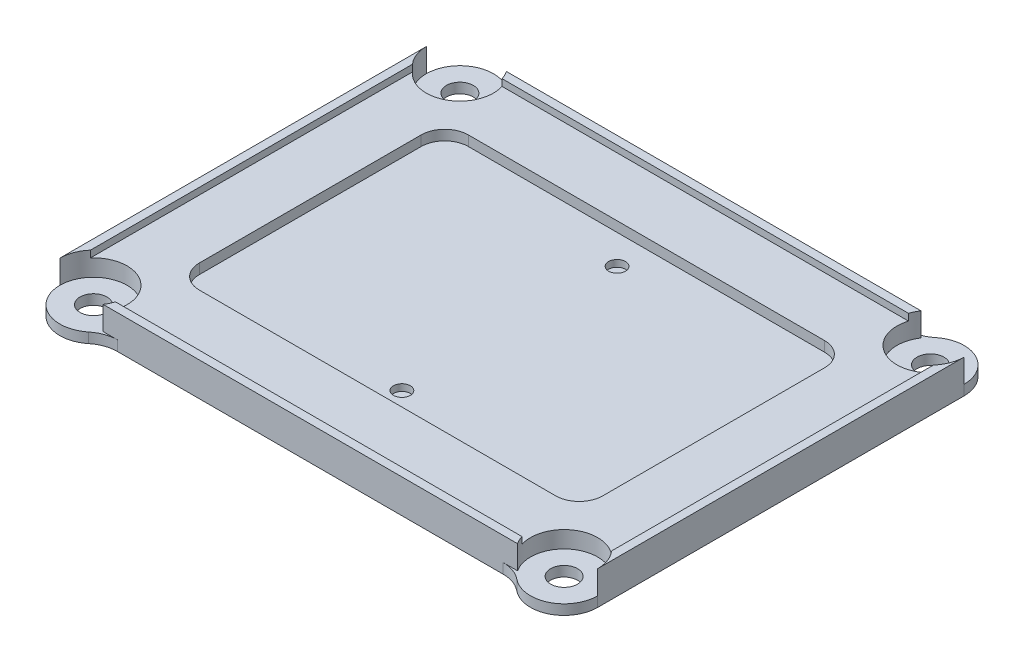
from build123d import *

# Parameters (mm, degrees)
SKETCH1_W               = 160
SKETCH1_H               = 129
BOSS_EXTRUDE1_DEPTH     = 8
SKETCH1_3_R             = 4
CUT_EXTRUDE2_DEPTH      = 104.074002542
FILLET1_R               = 10
CUT_EXTRUDE4_DEPTH      = 1
CUT_EXTRUDE4_DEPTH_BACK = 3
CUT_EXTRUDE4_START      = 8
CUT_EXTRUDE9_DEPTH      = 104.074002542
CUT_EXTRUDE10_START     = 8
SKETCH1_17_R            = 2.5
SKETCH1_17_R_2          = 10
CUT_EXTRUDE10_DEPTH     = 5
BOSS_EXTRUDE4_START     = 10
BOSS_EXTRUDE4_DEPTH     = 10
FILLET2_R               = 10


with BuildPart() as part:
    # Sketch1 → Boss-Extrude1 (new body)
    with BuildSketch(Plane(origin=(0, 0, 0), x_dir=(1, 0, 0), z_dir=(0, 1, 0))):
        Rectangle(SKETCH1_W, SKETCH1_H)
    extrude(amount=BOSS_EXTRUDE1_DEPTH)

    # Sketch1<3> → Cut-Extrude2 (cut, through all)
    with BuildSketch(Plane(origin=(0, 0, 0), x_dir=(1, 0, 0), z_dir=(0, 1, 0))):
        with Locations(Location((-70, 54.5, 0), (0, 0, 270))):
            Circle(SKETCH1_3_R)
        with Locations(Location((-70, -54.5, 0), (0, 0, 270))):
            Circle(SKETCH1_3_R)
        with Locations(Location((70, -54.5, 0), (0, 0, 90))):
            Circle(SKETCH1_3_R)
        with Locations(Location((70, 54.5, 0), (0, 0, 90))):
            Circle(SKETCH1_3_R)
    extrude(amount=CUT_EXTRUDE2_DEPTH, mode=Mode.SUBTRACT)

    # Fillet1
    fillet1_edges = [part.edges().sort_by_distance(p)[0] for p in [
        (80, 4, 64.5),
        (-80, 4, 64.5),
        (-80, 4, -64.5),
        (80, 4, -64.5),
    ]]
    fillet(fillet1_edges, radius=FILLET1_R)

    # Sketch1<11> → Cut-Extrude4 (cut, two sides: drawn at the far end of the back side and taken through both)
    with BuildSketch(Plane(origin=(0, 0, 0), x_dir=(1, 0, 0), z_dir=(0, 1, 0)).offset(CUT_EXTRUDE4_START - CUT_EXTRUDE4_DEPTH_BACK)):
        with BuildLine():
            Line((53, -40), (-53, -40))
            ThreePointArc((-53, -40), (-57.949747468, -37.949747468), (-60, -33))
            Line((-60, -33), (-60, 33))
            ThreePointArc((-60, 33), (-57.949747468, 37.949747468), (-53, 40))
            Line((-53, 40), (53, 40))
            ThreePointArc((53, 40), (57.949747468, 37.949747468), (60, 33))
            Line((60, 33), (60, -33))
            ThreePointArc((60, -33), (57.949747468, -37.949747468), (53, -40))
        make_face()
    extrude(amount=CUT_EXTRUDE4_DEPTH + CUT_EXTRUDE4_DEPTH_BACK, mode=Mode.SUBTRACT)

    # Sketch1<13> → Cut-Extrude9 (cut, through all)
    with BuildSketch(Plane(origin=(0, 0, 0), x_dir=(1, 0, 0), z_dir=(0, 1, 0))):
        with BuildLine():
            Line((-70, -64.5), (70, -64.5))
            ThreePointArc((70, -64.5), (65.25658351, -63.303408431), (61.648353456, -60))
            Line((61.648353456, -60), (-61.648353456, -60))
            ThreePointArc((-61.648353456, -60), (-65.25658351, -63.303408431), (-70, -64.5))
        make_face()
        with BuildLine():
            ThreePointArc((61.648353456, 60), (65.25658351, 63.303408431), (70, 64.5))
            Line((70, 64.5), (-69.999999984, 64.5))
            ThreePointArc((-69.999999984, 64.5), (-65.256583502, 63.303408427), (-61.648353456, 60))
            Line((-61.648353456, 60), (61.648353456, 60))
        make_face()
    extrude(amount=CUT_EXTRUDE9_DEPTH, mode=Mode.SUBTRACT)

    # Sketch1<17> → Cut-Extrude10 (cut)
    with BuildSketch(Plane(origin=(0, 0, 0), x_dir=(1, 0, 0), z_dir=(0, 1, 0)).offset(CUT_EXTRUDE10_START)):
        with Locations(Location((0, 31.25, 0), (0, 0, 270))):
            Circle(SKETCH1_17_R)
        with Locations((-70, 54.5)):
            Circle(SKETCH1_17_R_2)
        with Locations((70, 54.5)):
            Circle(SKETCH1_17_R_2)
        with Locations((-70, -54.5)):
            Circle(SKETCH1_17_R_2)
        with Locations((70, -54.5)):
            Circle(SKETCH1_17_R_2)
        with Locations(Location((0, -32.75, 0), (0, 0, 270))):
            Circle(SKETCH1_17_R)
    extrude(amount=-CUT_EXTRUDE10_DEPTH, mode=Mode.SUBTRACT)

    # Sketch1<18> → Boss-Extrude4 (add)
    with BuildSketch(Plane(origin=(0, 0, 0), x_dir=(1, 0, 0), z_dir=(0, 1, 0)).offset(BOSS_EXTRUDE4_START)):
        with BuildLine():
            ThreePointArc((60.460607986, 57.5), (60.967568701, 58.791291743), (61.648353456, 60))
            Line((61.648353456, 60), (-61.648353456, 60))
            ThreePointArc((-61.648353456, 60), (-60.967568701, 58.791291743), (-60.460607986, 57.5))
            Line((-60.460607986, 57.5), (60.460607986, 57.5))
        make_face()
        with BuildLine():
            Line((-80, 54.500000177), (-80, -54.5))
            ThreePointArc((-80, -54.5), (-79.354143467, -50.964466094), (-77.5, -47.885621722))
            Line((-77.5, -47.885621722), (-77.5, 47.885621722))
            ThreePointArc((-77.5, 47.885621722), (-79.354143498, 50.964466177), (-80, 54.500000177))
        make_face()
        with BuildLine():
            ThreePointArc((77.5, -47.885621722), (79.354143467, -50.964466094), (80, -54.5))
            Line((80, -54.5), (80, 54.5))
            ThreePointArc((80, 54.5), (79.354143467, 50.964466094), (77.5, 47.885621722))
            Line((77.5, 47.885621722), (77.5, -47.885621722))
        make_face()
        with BuildLine():
            Line((-61.648353456, -60), (61.648353456, -60))
            ThreePointArc((61.648353456, -60), (60.967568701, -58.791291743), (60.460607986, -57.5))
            Line((60.460607986, -57.5), (-60.460607986, -57.5))
            ThreePointArc((-60.460607986, -57.5), (-60.967568701, -58.791291743), (-61.648353456, -60))
        make_face()
    extrude(amount=-BOSS_EXTRUDE4_DEPTH)

    # Fillet2
    # the kernel refuses this fillet: 10 mm, written as the material it adds along each edge
    with BuildSketch(Plane(origin=(61.648353456, 0, 60), x_dir=(0.6702455950029323, 0, 0.7421393685684416), z_dir=(0, 1, 0)), Plane(origin=(-61.648353456, 0, -60), x_dir=(-0.6702455950029282, 0, -0.7421393685684453), z_dir=(0, 1, 0))) as fillet2_piece_1:
        with BuildLine():
            CenterArc((4.547663341, -9.884436465), FILLET2_R, 98.719009802, 39.194967426)
            Line((-2.873730345, -3.181980515), (0, 0))
            ThreePointArc((0, 0), (1.51588778, -0.115563535), (3.03177556, 0))
        make_face()
    extrude(amount=3)
    with BuildSketch(Plane(origin=(-61.648353456, 0, 60), x_dir=(1, 0, 0), z_dir=(0, 1, 0))) as fillet2_piece_2:
        with BuildLine():
            CenterArc((4.287578116, -10), FILLET2_R, 90, 39.194967426)
            ThreePointArc((-2.032034214, -2.25), (-0.930252859, -1.20245595), (0, 0))
            Line((0, 0), (4.287578116, 0))
        make_face()
    extrude(amount=3)
    with BuildSketch(Plane(origin=(61.648353456, 0, -60), x_dir=(0.6702455950029361, 0, -0.7421393685684381), z_dir=(0, 1, 0))) as fillet2_piece_3:
        with BuildLine():
            CenterArc((4.547663341, 9.884436465), FILLET2_R, 222.086022772, 39.194967426)
            Line((-2.873730345, 3.181980515), (0, 0))
            ThreePointArc((0, 0), (1.51588778, 0.115563535), (3.03177556, 0))
        make_face()
    extrude(amount=3)


solid = part.part
